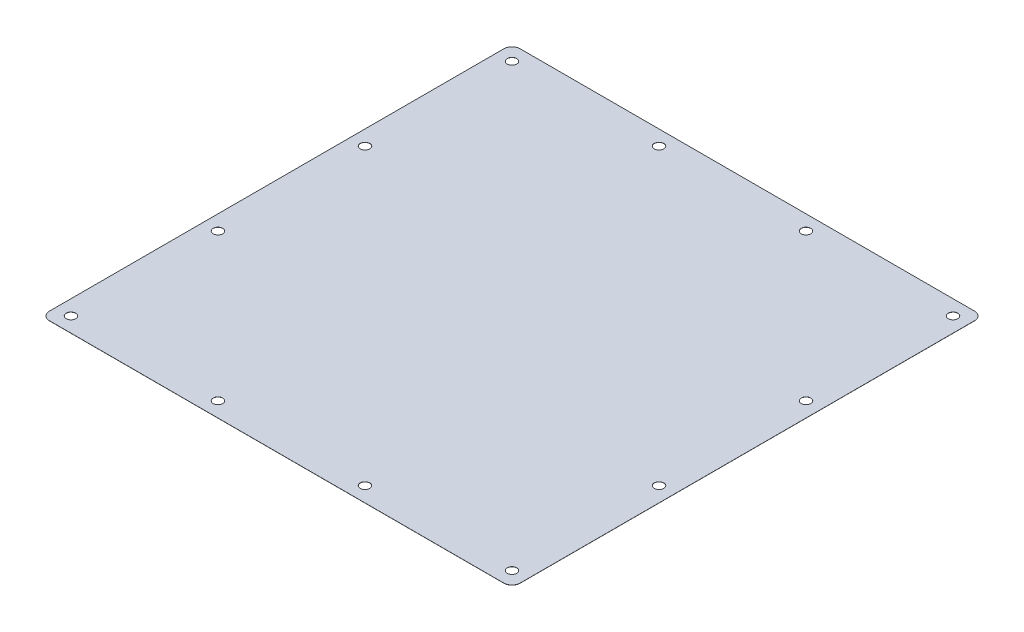
from build123d import *

# Parameters (mm, degrees)
BASE_FLANGE1_DEPTH    = 0.0508
F_6_CLEARANCE_HOLE1_D = 3.6576


# Sheet-metal steps are written as plain solids
with BuildPart() as part:
    # Sketch2 → Base-Flange1 (new body)
    with BuildSketch(Plane(origin=(0, 0, 0), x_dir=(1, 0, 0), z_dir=(0, 1, 0))):
        with BuildLine():
            Line((3.175, 0), (177.038, 0))
            ThreePointArc((177.038, 0), (179.28306403, 0.92993597), (180.213, 3.175))
            Line((180.213, 3.175), (180.213, 177.038))
            ThreePointArc((180.213, 177.038), (179.28306403, 179.28306403), (177.038, 180.213))
            Line((177.038, 180.213), (3.175, 180.213))
            ThreePointArc((3.175, 180.213), (0.92993597, 179.28306403), (0, 177.038))
            Line((0, 177.038), (0, 3.175))
            ThreePointArc((0, 3.175), (0.92993597, 0.92993597), (3.175, 0))
        make_face()
    extrude(amount=-BASE_FLANGE1_DEPTH)

    # #6 Clearance Hole1 (through all)
    with Locations(Plane(origin=(0, 0, 0), x_dir=(1, 0, 0), z_dir=(0, 1, 0))):
        with Locations((118.237, 5.715), (174.498, 5.715), (174.498, 61.976), (174.498, 118.237), (174.498, 174.498), (118.237, 174.498), (61.976, 174.498), (5.715, 174.498), (5.715, 118.237), (5.715, 61.976), (5.715, 5.715), (61.976, 5.715)):
            Hole(F_6_CLEARANCE_HOLE1_D / 2)


solid = part.part
